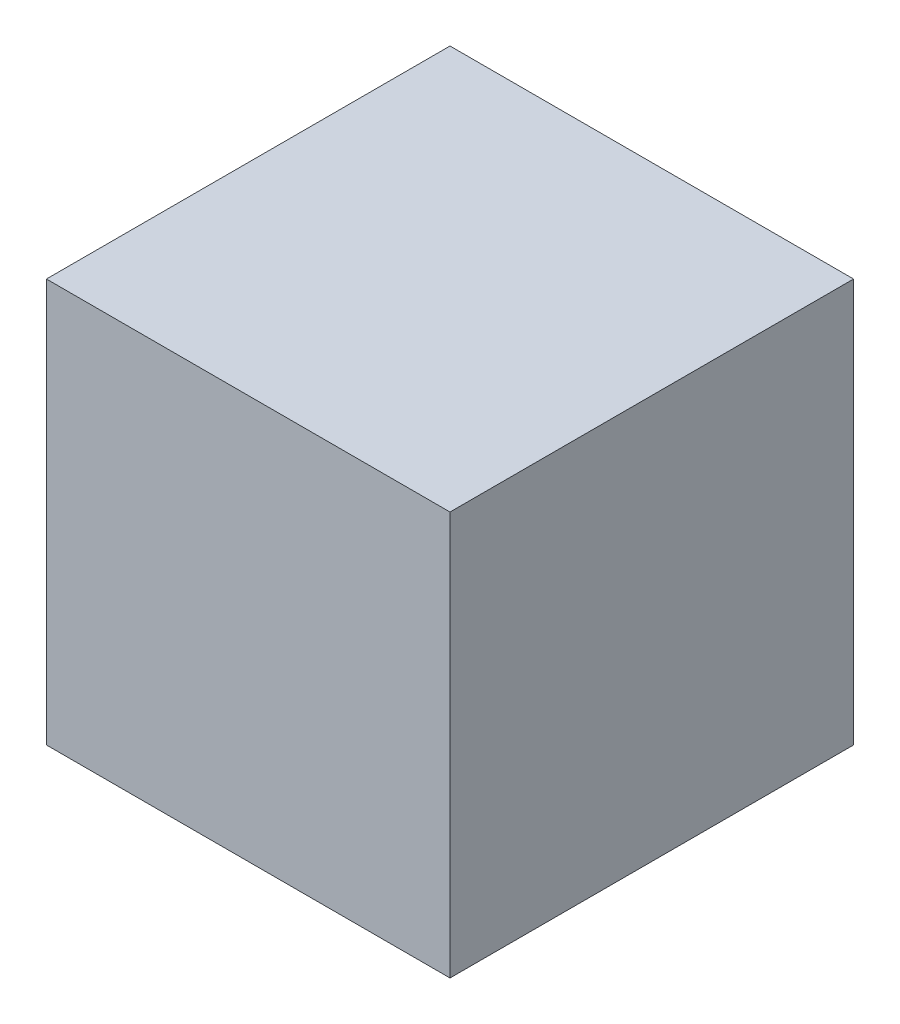
from build123d import *

# Parameters (mm, degrees)
SKETCH1_W           = 127
SKETCH1_H           = 127
BOSS_EXTRUDE1_DEPTH = 127


with BuildPart() as part:
    # Sketch1 → Boss-Extrude1 (new body)
    with BuildSketch(Plane(origin=(0, 0, 0), x_dir=(1, 0, 0), z_dir=(0, 1, 0))):
        with Locations((63.5, 63.5)):
            Rectangle(SKETCH1_W, SKETCH1_H)
    extrude(amount=BOSS_EXTRUDE1_DEPTH)


solid = part.part
